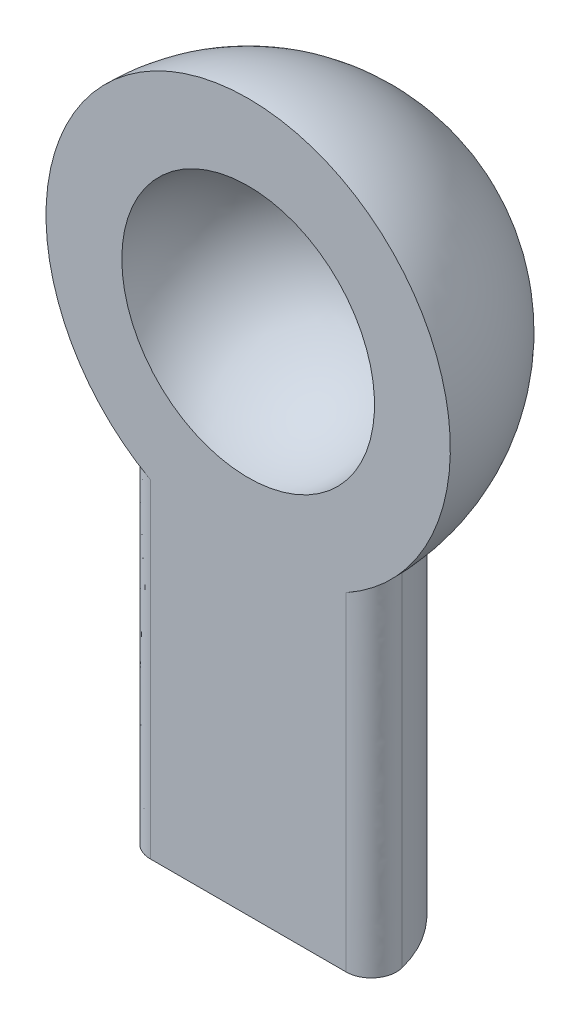
from build123d import *

# Parameters (mm, degrees)
REVOLVE1_ANGLE = 180
VARFILLET4_R   = 1


with BuildPart() as part:
    # Sketch2 → Revolve1 (revolve)
    with BuildSketch(Plane.XY):
        with BuildLine():
            Line((-5, 0), (0, 0))
            Line((0, 0), (0, 15))
            ThreePointArc((0, 15), (-5, 20), (0, 25))
            Line((0, 25), (0, 28))
            ThreePointArc((0, 28), (-7.548509256, 22.649529771), (-5, 13.755002002))
            Line((-5, 13.755002002), (-5, 0))
        make_face()
    revolve(axis=Axis((0, 0, 0), (0, -1, 0)), revolution_arc=REVOLVE1_ANGLE)

    # VarFillet4
    varfillet4_edges = [part.edges().sort_by_distance(p)[0] for p in [
        (5, 6.877501001, 0),
        (-5, 6.877501001, 0),
    ]]
    fillet(varfillet4_edges, radius=VARFILLET4_R)


solid = part.part
